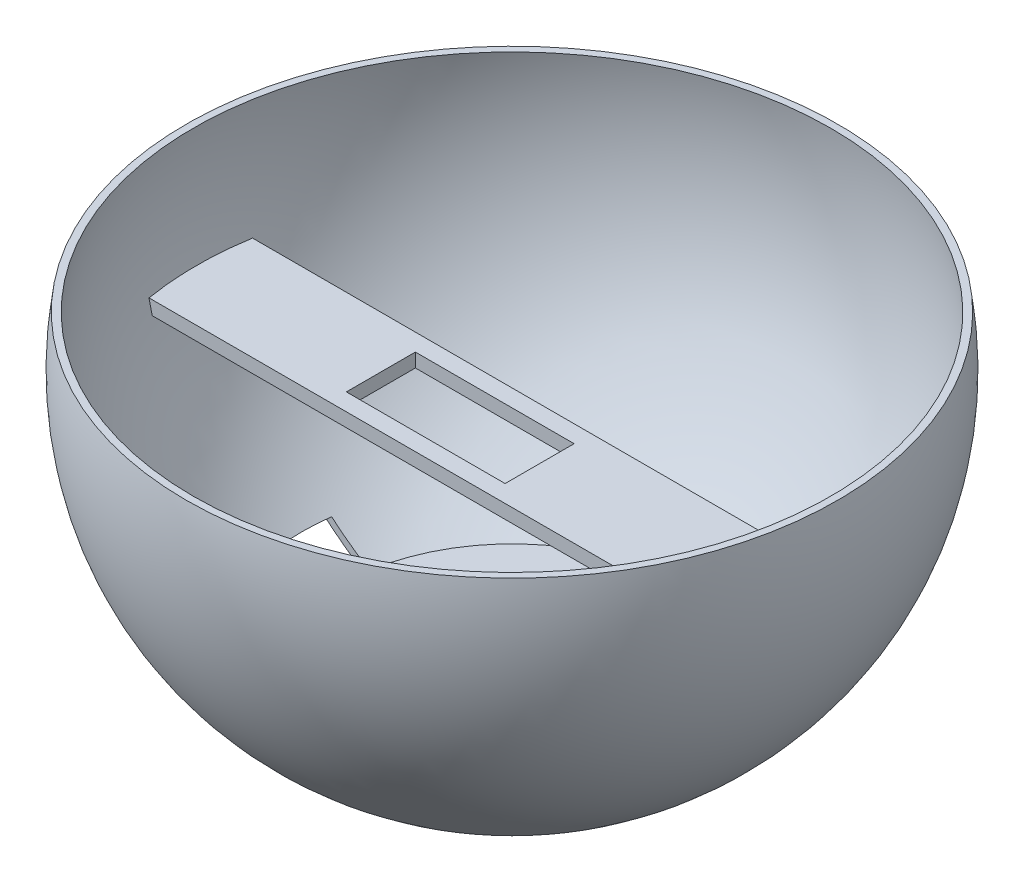
from build123d import *

# Parameters (mm, degrees)
SHELL_1_T           = -1
EXTRUDE_1_REACH     = 80.75
SKETCH_2_W          = 15
SKETCH_2_H          = 2
EXTRUDE_2_REACH     = 80.75
SKETCH_4_W          = 15
SKETCH_4_H          = 2
SKETCH_5_W          = 23
SKETCH_5_H          = 10
CUT_EXTRUDE_1_DEPTH = 10
SKETCH_6_W          = 8
SKETCH_6_H          = 4
CUT_EXTRUDE_2_DEPTH = 47


with BuildPart() as part:
    # 草图1 → 旋转1 (revolve)
    with BuildSketch(Plane(origin=(0, 0, 0), x_dir=(0, 0, -1), z_dir=(1, 0, 0))):
        with BuildLine():
            Line((-47.200739576, 7.221681487), (0, 7.221681487))
            Line((0, 7.221681487), (0, -40.513710474))
            Line((0, -40.513710474), (-25.272549608, -40.513710474))
            ThreePointArc((-25.272549608, -40.513710474), (-43.390797673, -19.932415241), (-47.200739576, 7.221681487))
        make_face()
    revolve(axis=Axis((0, 7.221681487, 0), (0, -1, 0)))

    # 抽壳1
    shell_1_openings = [part.faces().sort_by_distance(p)[0] for p in [
        (0, 7.221681487, 0),
    ]]
    offset(amount=SHELL_1_T, openings=shell_1_openings, kind=Kind.INTERSECTION)

    # 草图2 → 凸台-拉伸1 (add, up to next)
    with BuildSketch(Plane(origin=(0, 0, 0), x_dir=(0, 0, -1), z_dir=(1, 0, 0)), mode=Mode.PRIVATE) as extrude_1_sk1:
        with Locations((0, -10.778318513)):
            Rectangle(SKETCH_2_W, SKETCH_2_H)
    extrude_1_tool1 = extrude(extrude_1_sk1.sketch, amount=EXTRUDE_1_REACH, mode=Mode.PRIVATE) - part.part
    add(extrude_1_tool1.solids().sort_by_distance((0, -10.778319, 0))[0])

    # 草图4 → 凸台-拉伸2 (add, up to next)
    with BuildSketch(Plane(origin=(0, 0, 0), x_dir=(0, 0, -1), z_dir=(1, 0, 0)), mode=Mode.PRIVATE) as extrude_2_sk1:
        with Locations((0, -10.778318513)):
            Rectangle(SKETCH_4_W, SKETCH_4_H)
    extrude_2_tool1 = extrude(extrude_2_sk1.sketch, amount=-EXTRUDE_2_REACH, mode=Mode.PRIVATE) - part.part
    add(extrude_2_tool1.solids().sort_by_distance((0, -10.778319, 0))[0])

    # 草图5 → 切除-拉伸1 (cut)
    with BuildSketch(Plane(origin=(0, -9.778318513, 0), x_dir=(1, 0, 0), z_dir=(0, 1, 0))):
        with Locations((-7.5, 0)):
            Rectangle(SKETCH_5_W, SKETCH_5_H)
    extrude(amount=-CUT_EXTRUDE_1_DEPTH, mode=Mode.SUBTRACT)

    # 草图6 → 切除-拉伸2 (cut)
    with BuildSketch(Plane(origin=(0, 0, 0), x_dir=(0, 0, -1), z_dir=(1, 0, 0))):
        with Locations((0, -37.513710474)):
            Rectangle(SKETCH_6_W, SKETCH_6_H)
    extrude(amount=-CUT_EXTRUDE_2_DEPTH, mode=Mode.SUBTRACT)


solid = part.part
